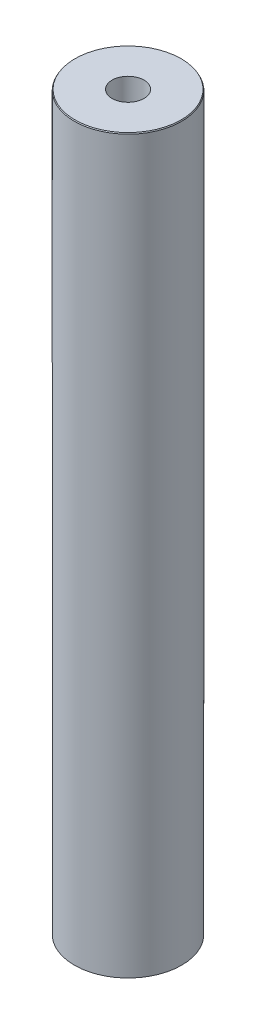
from build123d import *
from OCP.BRepFilletAPI import BRepFilletAPI_MakeChamfer

# Parameters (mm, degrees)
SKETCH1_R           = 35
BOSS_EXTRUDE1_DEPTH = 478.020058115
SKETCH2_R           = 10.41301529
CUT_EXTRUDE1_DEPTH  = 481.575879503
CHAMFER1_SIZE       = 0.649642662
CHAMFER1_SIZE2      = 0.375071366


with BuildPart() as part:
    # Sketch1 → Boss-Extrude1 (new body)
    with BuildSketch(Plane(origin=(0, 0, 0), x_dir=(1, 0, 0), z_dir=(0, 1, 0))):
        Circle(SKETCH1_R)
    extrude(amount=BOSS_EXTRUDE1_DEPTH)

    # Sketch2 → Cut-Extrude1 (cut, through all)
    with BuildSketch(Plane(origin=(0, 0, 0), x_dir=(1, 0, 0), z_dir=(0, 1, 0))):
        Circle(SKETCH2_R)
    extrude(amount=CUT_EXTRUDE1_DEPTH, mode=Mode.SUBTRACT)

    # Chamfer1: one chamfer whose edges measure the first distance from different faces: ONE call of the kernel's chamfer builder (chamfer() names one face for all edges)
    chamfer1_edges_1 = [part.edges().sort_by_distance(p)[0] for p in [
        (-35, 478.020058115, 0),
    ]]
    chamfer1_side_1 = [part.faces().sort_by_distance(p)[0] for p in [
        (-35, 239.010029057, 0),
    ]]
    chamfer1_edges_2 = [part.edges().sort_by_distance(p)[0] for p in [
        (-35, 0, 0),
    ]]
    chamfer1_side_2 = [part.faces().sort_by_distance(p)[0] for p in [
        (-34.010050506, 0, 0),
    ]]
    chamfer1 = BRepFilletAPI_MakeChamfer(part.part.solid().wrapped)
    for e in chamfer1_edges_1:
        chamfer1.Add(CHAMFER1_SIZE, CHAMFER1_SIZE2, e.wrapped, chamfer1_side_1[0].wrapped)  # the first distance lies on this face
    for e in chamfer1_edges_2:
        chamfer1.Add(CHAMFER1_SIZE, CHAMFER1_SIZE2, e.wrapped, chamfer1_side_2[0].wrapped)  # the first distance lies on this face
    add(Compound.cast(chamfer1.Shape()), mode=Mode.REPLACE)


solid = part.part
